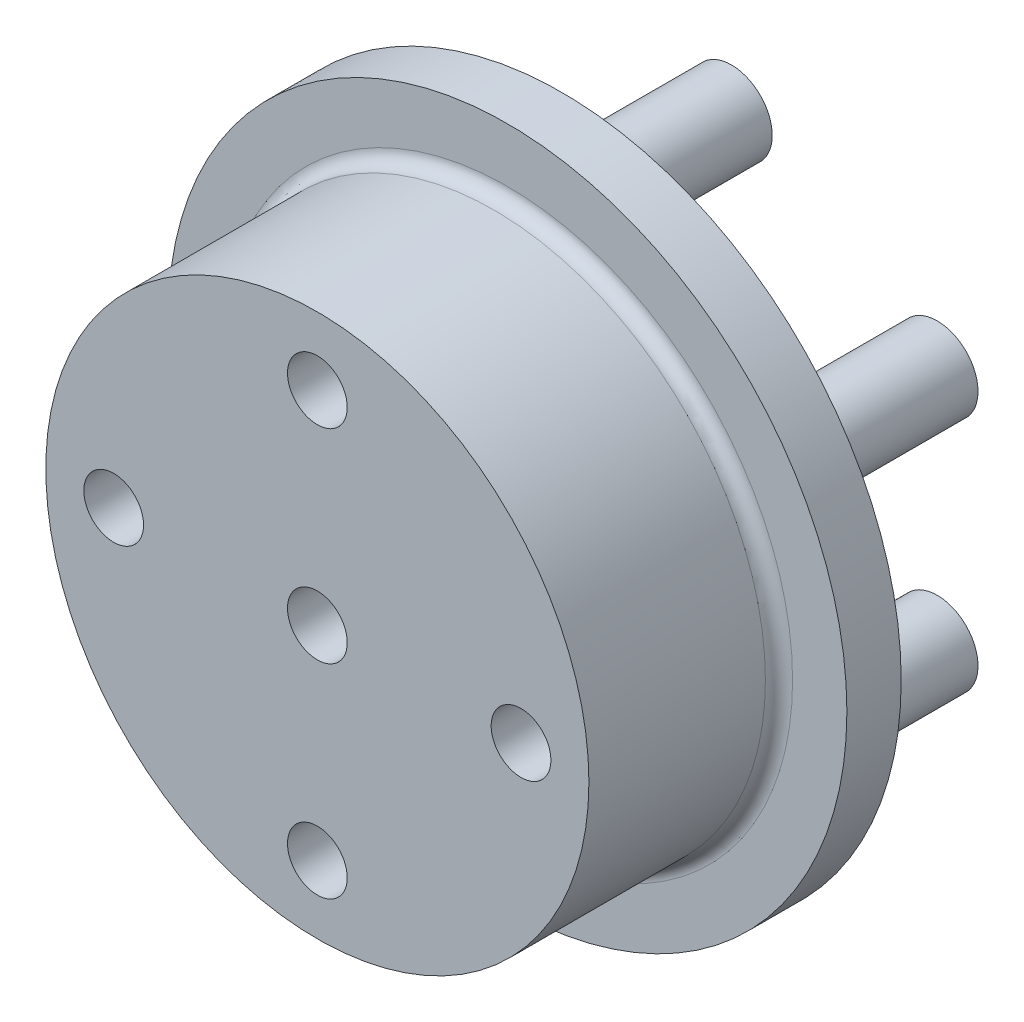
from build123d import *

# Parameters (mm, degrees)
SKETCH1_R                 = 25
BOSS_EXTRUDE1_DEPTH       = 4
SKETCH2_R                 = 20
BOSS_EXTRUDE2_DEPTH       = 14
FILLET1_R                 = 1
SKETCH3_R                 = 10.2
CUT_EXTRUDE1_DEPTH        = 5
SKETCH4_R                 = 3
BOSS_EXTRUDE3_DEPTH       = 12.5
F_4_0MM_DOWEL_HOLE1_D     = 4.4
F_4_0MM_DOWEL_HOLE1_DEPTH = 8
F_4_0MM_DOWEL_HOLE1_TIP   = 1.321893362


with BuildPart() as part:
    # Sketch1 → Boss-Extrude1 (new body)
    with BuildSketch(Plane.XY):
        Circle(SKETCH1_R)
    extrude(amount=-BOSS_EXTRUDE1_DEPTH)

    # Sketch2 → Boss-Extrude2 (add)
    with BuildSketch(Plane.XY):
        Circle(SKETCH2_R)
    extrude(amount=BOSS_EXTRUDE2_DEPTH)

    # Fillet1
    fillet1_edges = [part.edges().sort_by_distance(p)[0] for p in [
        (-20, 0, 0),
    ]]
    fillet(fillet1_edges, radius=FILLET1_R)

    # Sketch3 → Cut-Extrude1 (cut)
    with BuildSketch(Plane(origin=(0, 0, -4), x_dir=(-1, 0, 0), z_dir=(0, 0, -1))):
        Circle(SKETCH3_R)
    extrude(amount=-CUT_EXTRUDE1_DEPTH, mode=Mode.SUBTRACT)

    # Sketch4 → Boss-Extrude3 (add)
    with BuildSketch(Plane(origin=(0, 0, -4), x_dir=(-1, 0, 0), z_dir=(0, 0, -1))):
        with Locations((0, 17.5)):
            Circle(SKETCH4_R)
        with Locations((15.155444566, 8.75)):
            Circle(SKETCH4_R)
        with Locations((15.155444566, -8.75)):
            Circle(SKETCH4_R)
        with Locations((0, -17.5)):
            Circle(SKETCH4_R)
        with Locations((-15.155444566, -8.75)):
            Circle(SKETCH4_R)
        with Locations((-15.155444566, 8.75)):
            Circle(SKETCH4_R)
    extrude(amount=BOSS_EXTRUDE3_DEPTH)

    # Ø4.0mm Dowel Hole1
    with Locations(Plane.XY.offset(14)):
        with Locations((0, 0), (0, 15), (15, 0), (0, -15), (-15, 0)):
            Hole(F_4_0MM_DOWEL_HOLE1_D / 2, depth=F_4_0MM_DOWEL_HOLE1_DEPTH)
            with Locations((0, 0, -(F_4_0MM_DOWEL_HOLE1_DEPTH + F_4_0MM_DOWEL_HOLE1_TIP / 2))):  # 118° drill point
                Cone(0, F_4_0MM_DOWEL_HOLE1_D / 2, F_4_0MM_DOWEL_HOLE1_TIP, mode=Mode.SUBTRACT)


solid = part.part
